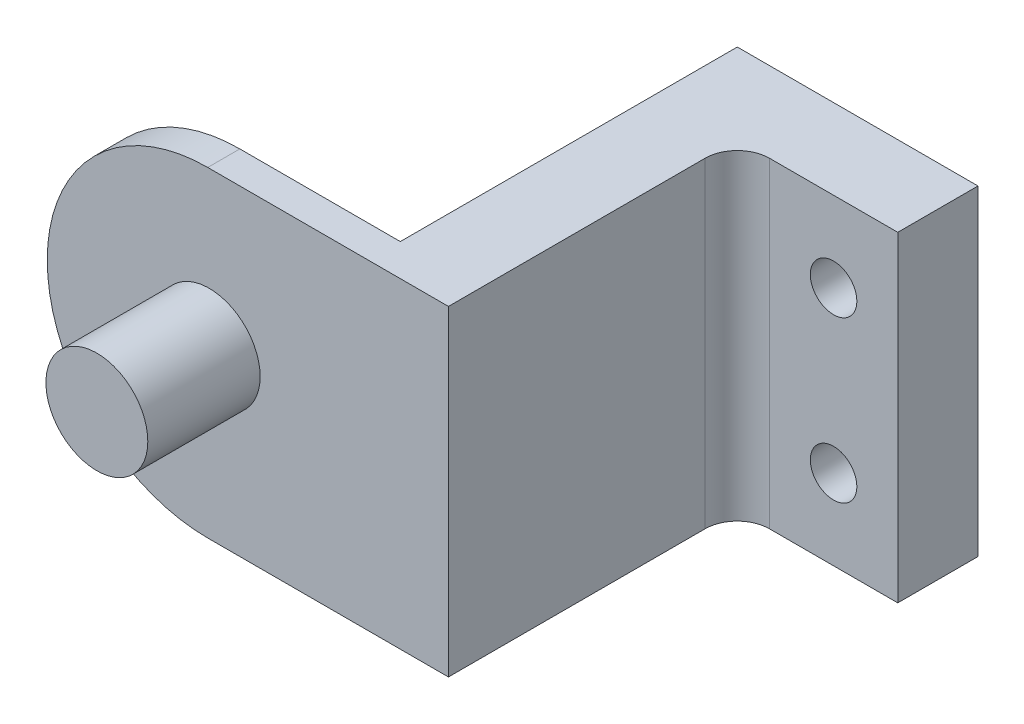
from build123d import *

# Parameters (mm, degrees)
ESQUISSE1_W             = 5
ESQUISSE1_H             = 20
BOSS_EXTRU_1_DEPTH      = 21
ESQUISSE2_W             = 25
ESQUISSE2_H             = 20
BOSS_EXTRU_2_DEPTH      = 2
ESQUISSE3_R             = 3.175
BOSS_EXTRU_3_DEPTH      = 7
CONG_1_R                = 10
ESQUISSE5_W             = 5
ESQUISSE5_H             = 20
BOSS_EXTRU_4_DEPTH      = 10
CONG_2_R                = 2
ENL_V_MAT_EXTRU_1_REACH = 37.089
ESQUISSE6_R             = 1.45


with BuildPart() as part:
    # Esquisse1 → Boss.-Extru.1 (new body)
    with BuildSketch(Plane.XY):
        Rectangle(ESQUISSE1_W, ESQUISSE1_H)
    extrude(amount=BOSS_EXTRU_1_DEPTH)

    # Esquisse2 → Boss.-Extru.2 (add)
    with BuildSketch(Plane.XY.offset(21)):
        with Locations((-10, 0)):
            Rectangle(ESQUISSE2_W, ESQUISSE2_H)
    extrude(amount=BOSS_EXTRU_2_DEPTH)

    # Esquisse3 → Boss.-Extru.3 (add)
    with BuildSketch(Plane.XY.offset(23)):
        with Locations((-12.41, 0.35)):
            Circle(ESQUISSE3_R)
    extrude(amount=BOSS_EXTRU_3_DEPTH)

    # Congé1
    cong_1_edges = [part.edges().sort_by_distance(p)[0] for p in [
        (-22.5, 10, 22),
        (-22.5, -10, 22),
    ]]
    fillet(cong_1_edges, radius=CONG_1_R - 0.0001)  # a hair under: the kernel refuses the full size

    # Esquisse5 → Boss.-Extru.4 (add)
    with BuildSketch(Plane(origin=(2.5, 0, 0), x_dir=(0, 0, -1), z_dir=(1, 0, 0))):
        with Locations((-2.5, 0)):
            Rectangle(ESQUISSE5_W, ESQUISSE5_H)
    extrude(amount=BOSS_EXTRU_4_DEPTH)

    # Congé2
    cong_2_edges = [part.edges().sort_by_distance(p)[0] for p in [
        (2.5, 0, 5),
    ]]
    fillet(cong_2_edges, radius=CONG_2_R)

    # Esquisse6 → Enlèv. mat.-Extru.1 (cut, up to next)
    with BuildSketch(Plane.XY.offset(5), mode=Mode.PRIVATE) as enl_v_mat_extru_1_sk1:
        with Locations((8.5, 5)):
            Circle(ESQUISSE6_R)
    enl_v_mat_extru_1_tool1 = extrude(enl_v_mat_extru_1_sk1.sketch, amount=-ENL_V_MAT_EXTRU_1_REACH, mode=Mode.PRIVATE) & part.part
    # Esquisse6 → Enlèv. mat.-Extru.1 (cut, up to next)
    with BuildSketch(Plane.XY.offset(5), mode=Mode.PRIVATE) as enl_v_mat_extru_1_sk2:
        with Locations((8.5, -5)):
            Circle(ESQUISSE6_R)
    enl_v_mat_extru_1_tool2 = extrude(enl_v_mat_extru_1_sk2.sketch, amount=-ENL_V_MAT_EXTRU_1_REACH, mode=Mode.PRIVATE) & part.part
    add(enl_v_mat_extru_1_tool1.solids().sort_by_distance((8.5, 5, 5))[0], mode=Mode.SUBTRACT)
    add(enl_v_mat_extru_1_tool2.solids().sort_by_distance((8.5, -5, 5))[0], mode=Mode.SUBTRACT)


solid = part.part
